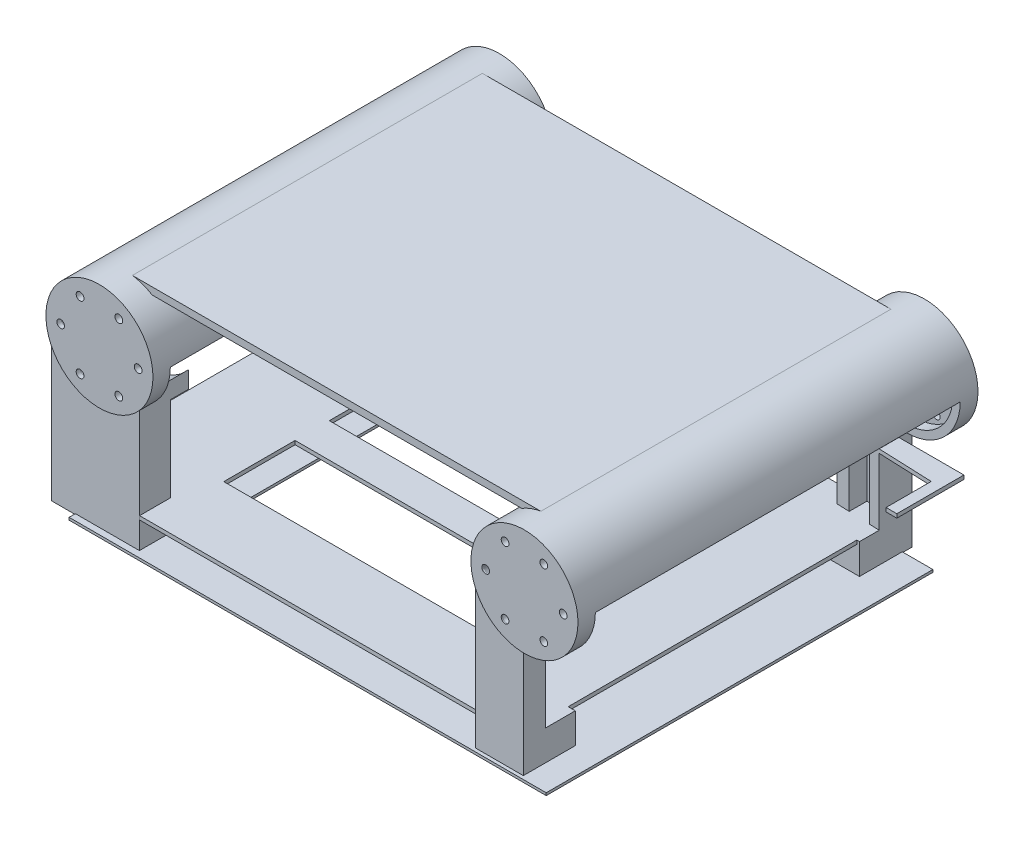
from build123d import *

# Parameters (mm, degrees)
MOTORHOLDERS_DEPTH            = 80
MOTORHOLDERS_DEPTH_BACK       = 80
MOTORHOLDERSSKETCH_R          = 21.41
MOTORHOLDERS_2_DEPTH          = 80
MOTORHOLDERS_2_DEPTH_BACK     = 80
BOSS_EXTRUDE2_DEPTH           = 70
BOSS_EXTRUDE2_DEPTH_BACK      = 70
SKETCH3_W                     = 166.402948119
SKETCH3_H                     = 2.817422897
SKETCH4_W                     = 262.774983374
SKETCH4_H                     = 145.919891702
CUT_EXTRUDE1_DEPTH            = 23
POWERBANKHOLDERS_DEPTH        = 30
POWERBANKHOLDERS_DEPTH_BACK   = 35
SKETCH6_W                     = 36.49467874
SKETCH6_H                     = 22.639087533
SKETCH6_W_2                   = 31.056806986
SKETCH6_H_2                   = 11.734008709
POWERBANKHOLDERS_2_DEPTH      = 30
POWERBANKHOLDERS_2_DEPTH_BACK = 35
SKETCH6_W_3                   = 35.167265393
SKETCH6_H_3                   = 19.610970688
SKETCH6_W_4                   = 27.697880098
SKETCH6_H_4                   = 9.83070569
POWERBANKHOLDERS_3_DEPTH      = 30
POWERBANKHOLDERS_3_DEPTH_BACK = 35
SKETCH6_W_5                   = 17.542642612
SKETCH6_H_5                   = 21.099390751
SKETCH6_W_6                   = 8.482440028
POWERBANKHOLDERS_4_DEPTH      = 30
POWERBANKHOLDERS_4_DEPTH_BACK = 35
SKETCH6_W_7                   = 19.167029737
SKETCH6_H_6                   = 20.772476447
SKETCH6_W_8                   = 10.64703133
SKETCH7_W                     = 190.824703485
SKETCH7_H                     = 154.667210728
SKETCH7_W_2                   = 125.335149465
SKETCH7_H_2                   = 100.638457321
TOPCELLPHONECOVER_DEPTH       = 1
MOTORHOLDEREXTRUDE_DEPTH      = 77
MOTORHOLDEREXTRUDE_DEPTH_BACK = 77
MOTORHOLDEREXTRUDESKETCH_R    = 18.415
CUT_EXTRUDE9_DEPTH            = 10
SKETCH13_W                    = 185.613395506
SKETCH13_H                    = 150.750513965
SKETCH13_W_2                  = 118.643379197
SKETCH13_H_2                  = 28.528180577
SKETCH13_H_3                  = 20.354411311
SKETCH13_H_4                  = 25.680107897
TOPOFPOWERBANKEXTRUDE_DEPTH   = 1.5
SKETCH15_W                    = 26.821383844
SKETCH15_H                    = 1.552281475
POWERBANKSMALLHOLDER1_DEPTH   = 26
POWERBANKEXTRUDE_DEPTH        = 34
SKETCH17_R                    = 1.55
BOLTHOLES1_DEPTH              = 31.5
SKETCH19_R                    = 1.55
BOLTHOLES2_DEPTH              = 31.5
BOLTHOLESSKETCH3_R            = 1.55
BOLTHOLES3_DEPTH              = 31.5
BOLTHOLES4_START              = -15
BOLTHOLESSKETCH4_R            = 1.55
BOLTHOLES4_DEPTH              = 15


with BuildPart() as part:
    # MotorHoldersSketch → MotorHolders (new, two sides: drawn at the far end of the back side and taken through both)
    with BuildSketch(Plane.XY.offset(-MOTORHOLDERS_DEPTH_BACK)):
        Circle(MOTORHOLDERSSKETCH_R)
    extrude(amount=MOTORHOLDERS_DEPTH + MOTORHOLDERS_DEPTH_BACK)


with BuildPart() as body_2:
    # MotorHoldersSketch → MotorHolders 2 (new, two sides: drawn at the far end of the back side and taken through both)
    with BuildSketch(Plane.XY.offset(-MOTORHOLDERS_2_DEPTH_BACK)):
        with Locations((170, 0)):
            Circle(MOTORHOLDERSSKETCH_R)
    extrude(amount=MOTORHOLDERS_2_DEPTH + MOTORHOLDERS_2_DEPTH_BACK)

    # Sketch3 → Boss-Extrude2 (add, two sides: drawn at the far end of the back side and taken through both)
    with BuildSketch(Plane.XY.offset(-BOSS_EXTRUDE2_DEPTH_BACK)):
        with Locations((85.14207121, 19.724241304)):
            Rectangle(SKETCH3_W, SKETCH3_H)
    extrude(amount=BOSS_EXTRUDE2_DEPTH + BOSS_EXTRUDE2_DEPTH_BACK)


with BuildPart() as cut_extrude1_tool:
    # Sketch4 → Cut-Extrude1 (new body)
    with BuildSketch(Plane(origin=(0, 0, 0), x_dir=(1, 0, 0), z_dir=(0, 1, 0))):
        with Locations((89.893628689, -0.090874356)):
            Rectangle(SKETCH4_W, SKETCH4_H)
    extrude(amount=-CUT_EXTRUDE1_DEPTH)


with BuildPart() as part_1:
    add(part.part)

    # Cut-Extrude1: cut by cut_extrude1_tool
    add(cut_extrude1_tool.part, mode=Mode.SUBTRACT)


with BuildPart() as body_2_1:
    add(body_2.part)

    # Cut-Extrude1: cut by cut_extrude1_tool
    add(cut_extrude1_tool.part, mode=Mode.SUBTRACT)


with BuildPart() as body_3:
    # Sketch6 → PowerBankHolders (new, two sides: drawn at the far end of the back side and taken through both)
    with BuildSketch(Plane(origin=(170, -34.829272125, 0), x_dir=(-1, 0, 0), z_dir=(0, -1, 0)).offset(-POWERBANKHOLDERS_DEPTH_BACK)):
        with Locations((172.819067028, 67.629448186)):
            Rectangle(SKETCH6_W, SKETCH6_H)
        with Locations((173.298050861, 66.379140187)):
            Rectangle(SKETCH6_W_2, SKETCH6_H_2, mode=Mode.SUBTRACT)
    extrude(amount=POWERBANKHOLDERS_DEPTH + POWERBANKHOLDERS_DEPTH_BACK)



with BuildPart() as body_4:
    # Sketch6 → PowerBankHolders 2 (new, two sides: drawn at the far end of the back side and taken through both)
    with BuildSketch(Plane(origin=(170, -34.829272125, 0), x_dir=(-1, 0, 0), z_dir=(0, -1, 0)).offset(-POWERBANKHOLDERS_2_DEPTH_BACK)):
        with Locations((173.31036146, -68.476666678)):
            Rectangle(SKETCH6_W_3, SKETCH6_H_3)
        with Locations((174.225508828, -67.894738702)):
            Rectangle(SKETCH6_W_4, SKETCH6_H_4, mode=Mode.SUBTRACT)
    extrude(amount=POWERBANKHOLDERS_2_DEPTH + POWERBANKHOLDERS_2_DEPTH_BACK)


with BuildPart() as body_5:
    # Sketch6 → PowerBankHolders 3 (new, two sides: drawn at the far end of the back side and taken through both)
    with BuildSketch(Plane(origin=(170, -34.829272125, 0), x_dir=(-1, 0, 0), z_dir=(0, -1, 0)).offset(-POWERBANKHOLDERS_3_DEPTH_BACK)):
        with Locations((11.52721305, 67.312978676)):
            Rectangle(SKETCH6_W_5, SKETCH6_H_5)
        with Locations((11.033379358, 66.379140187)):
            Rectangle(SKETCH6_W_6, SKETCH6_H_2, mode=Mode.SUBTRACT)
    extrude(amount=POWERBANKHOLDERS_3_DEPTH + POWERBANKHOLDERS_3_DEPTH_BACK)


with BuildPart() as body_6:
    # Sketch6 → PowerBankHolders 4 (new, two sides: drawn at the far end of the back side and taken through both)
    with BuildSketch(Plane(origin=(170, -34.829272125, 0), x_dir=(-1, 0, 0), z_dir=(0, -1, 0)).offset(-POWERBANKHOLDERS_4_DEPTH_BACK)):
        with Locations((10.584217292, -69.057419557)):
            Rectangle(SKETCH6_W_7, SKETCH6_H_6)
        with Locations((9.951083707, -67.894738702)):
            Rectangle(SKETCH6_W_8, SKETCH6_H_4, mode=Mode.SUBTRACT)
    extrude(amount=POWERBANKHOLDERS_4_DEPTH + POWERBANKHOLDERS_4_DEPTH_BACK)


with BuildPart() as body_3_1:
    add(body_3.part)

    add(body_4.part)  # TopCellPhoneCover merges body 4

    add(body_5.part)  # TopCellPhoneCover merges body 5

    add(body_6.part)  # TopCellPhoneCover merges body 6
    # Sketch7 → TopCellPhoneCover (add)
    with BuildSketch(Plane(origin=(170, -64.5, 0), x_dir=(-1, 0, 0), z_dir=(0, -1, 0))):
        with Locations((85.907620295, -3.467393964)):
            Rectangle(SKETCH7_W, SKETCH7_H)
        with Locations((89.203645692, -4.077931617)):
            Rectangle(SKETCH7_W_2, SKETCH7_H_2, mode=Mode.SUBTRACT)
    extrude(amount=TOPCELLPHONECOVER_DEPTH)


with BuildPart() as motorholderextrude_tool:
    # MotorHolderExtrudeSketch → MotorHolderExtrude (new, two sides: drawn at the far end of the back side and taken through both)
    with BuildSketch(Plane.XY.offset(-MOTORHOLDEREXTRUDE_DEPTH_BACK)):
        with Locations((170, 0)):
            Circle(MOTORHOLDEREXTRUDESKETCH_R)
        Circle(MOTORHOLDEREXTRUDESKETCH_R)
    extrude(amount=MOTORHOLDEREXTRUDE_DEPTH + MOTORHOLDEREXTRUDE_DEPTH_BACK)


with BuildPart() as part_2:
    add(part_1.part)

    # MotorHolderExtrude: cut by motorholderextrude_tool
    add(motorholderextrude_tool.part, mode=Mode.SUBTRACT)


with BuildPart() as body_2_2:
    add(body_2_1.part)

    # MotorHolderExtrude: cut by motorholderextrude_tool
    add(motorholderextrude_tool.part, mode=Mode.SUBTRACT)


with BuildPart() as body_3_2:
    add(body_3_1.part)

    # MotorHolderExtrude: cut by motorholderextrude_tool
    add(motorholderextrude_tool.part, mode=Mode.SUBTRACT)

    # Sketch11 → Cut-Extrude9 (cut)
    with BuildSketch(Plane(origin=(0, -18.425, 0), x_dir=(1, 0, 0), z_dir=(0, 1, 0))):
        Polygon((-18.932660375, -64.758061011), (-18.932660375, 72.241938989), (188.932660375, 63.758061011), (188.932660375, -71.241938989), align=None)
    extrude(amount=-CUT_EXTRUDE9_DEPTH, mode=Mode.SUBTRACT)

    # Sketch13 → TopOfPowerBankExtrude (add)
    with BuildSketch(Plane(origin=(0, -52.425, 0), x_dir=(1, 0, 0), z_dir=(0, 1, 0))):
        with Locations((73.356932548, -2.829837215)):
            Rectangle(SKETCH13_W, SKETCH13_H)
        with Locations((78.639035232, -35.318957481)):
            Rectangle(SKETCH13_W_2, SKETCH13_H_2, mode=Mode.SUBTRACT)
        with Locations((78.639035232, 46.500602577)):
            Rectangle(SKETCH13_W_2, SKETCH13_H_3, mode=Mode.SUBTRACT)
        with Locations((78.639035232, 5.478585624)):
            Rectangle(SKETCH13_W_2, SKETCH13_H_4, mode=Mode.SUBTRACT)
    extrude(amount=-TOPOFPOWERBANKEXTRUDE_DEPTH)

    # Sketch15 → PowerBankSmallHolder1 (add)
    with BuildSketch(Plane(origin=(167.244108256, 0, 0), x_dir=(0, 0, -1), z_dir=(1, 0, 0))):
        with Locations((59.120582699, -25.000313322)):
            Rectangle(SKETCH15_W, SKETCH15_H)
    extrude(amount=POWERBANKSMALLHOLDER1_DEPTH)

    # Sketch11<2> → PowerBankExtrude (cut)
    with BuildSketch(Plane(origin=(0, -18.425, 0), x_dir=(1, 0, 0), z_dir=(0, 1, 0))):
        Polygon((-18.932660375, -64.758061011), (-18.932660375, 72.241938989), (188.932660375, 63.758061011), (188.932660375, -71.241938989), align=None)
    extrude(amount=-POWERBANKEXTRUDE_DEPTH, mode=Mode.SUBTRACT)


with BuildPart() as boltholes1_tool:
    # Sketch17 → BoltHoles1 (new body)
    with BuildSketch(Plane.XY.offset(80)):
        with Locations((185.5, 0)):
            Circle(SKETCH17_R)
        with Locations((177.75, -13.42)):
            Circle(SKETCH17_R)
        with Locations((162.25, -13.42)):
            Circle(SKETCH17_R)
        with Locations((154.5, 0)):
            Circle(SKETCH17_R)
        with Locations((162.25, 13.42)):
            Circle(SKETCH17_R)
        with Locations((177.75, 13.42)):
            Circle(SKETCH17_R)
    extrude(amount=-BOLTHOLES1_DEPTH)


with BuildPart() as body_2_3:
    add(body_2_2.part)

    # BoltHoles1: cut by boltholes1_tool
    add(boltholes1_tool.part, mode=Mode.SUBTRACT)


with BuildPart() as body_3_3:
    add(body_3_2.part)

    # BoltHoles1: cut by boltholes1_tool
    add(boltholes1_tool.part, mode=Mode.SUBTRACT)


with BuildPart() as boltholes2_tool:
    # Sketch19 → BoltHoles2 (new body)
    with BuildSketch(Plane(origin=(0, 0, -80), x_dir=(-1, 0, 0), z_dir=(0, 0, -1))):
        with Locations((-185.5, 0)):
            Circle(SKETCH19_R)
        with Locations((-177.75, -13.42)):
            Circle(SKETCH19_R)
        with Locations((-162.25, -13.42)):
            Circle(SKETCH19_R)
        with Locations((-154.5, 0)):
            Circle(SKETCH19_R)
        with Locations((-162.25, 13.42)):
            Circle(SKETCH19_R)
        with Locations((-177.75, 13.42)):
            Circle(SKETCH19_R)
    extrude(amount=-BOLTHOLES2_DEPTH)


with BuildPart() as body_2_4:
    add(body_2_3.part)

    # BoltHoles2: cut by boltholes2_tool
    add(boltholes2_tool.part, mode=Mode.SUBTRACT)


with BuildPart() as body_3_4:
    add(body_3_3.part)

    # BoltHoles2: cut by boltholes2_tool
    add(boltholes2_tool.part, mode=Mode.SUBTRACT)


with BuildPart() as boltholes3_tool:
    # BoltHolesSketch3 → BoltHoles3 (new body)
    with BuildSketch(Plane.XY.offset(80)):
        with Locations((7.75, -13.42)):
            Circle(BOLTHOLESSKETCH3_R)
        with Locations((15.5, 0)):
            Circle(BOLTHOLESSKETCH3_R)
        with Locations((7.75, 13.42)):
            Circle(BOLTHOLESSKETCH3_R)
        with Locations((-7.75, 13.42)):
            Circle(BOLTHOLESSKETCH3_R)
        with Locations((-15.5, 0)):
            Circle(BOLTHOLESSKETCH3_R)
        with Locations((-7.75, -13.42)):
            Circle(BOLTHOLESSKETCH3_R)
    extrude(amount=-BOLTHOLES3_DEPTH)


with BuildPart() as part_3:
    add(part_2.part)

    # BoltHoles3: cut by boltholes3_tool
    add(boltholes3_tool.part, mode=Mode.SUBTRACT)


with BuildPart() as body_3_5:
    add(body_3_4.part)

    # BoltHoles3: cut by boltholes3_tool
    add(boltholes3_tool.part, mode=Mode.SUBTRACT)


with BuildPart() as boltholes4_tool:
    # BoltHolesSketch4 → BoltHoles4 (new body)
    with BuildSketch(Plane(origin=(0, 0, -80), x_dir=(-1, 0, 0), z_dir=(0, 0, -1)).offset(BOLTHOLES4_START)):
        with Locations((-15.5, 0)):
            Circle(BOLTHOLESSKETCH4_R)
        with Locations((-7.75, 13.42)):
            Circle(BOLTHOLESSKETCH4_R)
        with Locations((7.75, 13.42)):
            Circle(BOLTHOLESSKETCH4_R)
        with Locations((15.5, 0)):
            Circle(BOLTHOLESSKETCH4_R)
        with Locations((7.75, -13.42)):
            Circle(BOLTHOLESSKETCH4_R)
        with Locations((-7.75, -13.42)):
            Circle(BOLTHOLESSKETCH4_R)
    extrude(amount=BOLTHOLES4_DEPTH)


with BuildPart() as part_4:
    add(part_3.part)

    # BoltHoles4: cut by boltholes4_tool
    add(boltholes4_tool.part, mode=Mode.SUBTRACT)


with BuildPart() as body_3_6:
    add(body_3_5.part)

    # BoltHoles4: cut by boltholes4_tool
    add(boltholes4_tool.part, mode=Mode.SUBTRACT)


solid = Compound([body_2_4.part, part_4.part, body_3_6.part])
